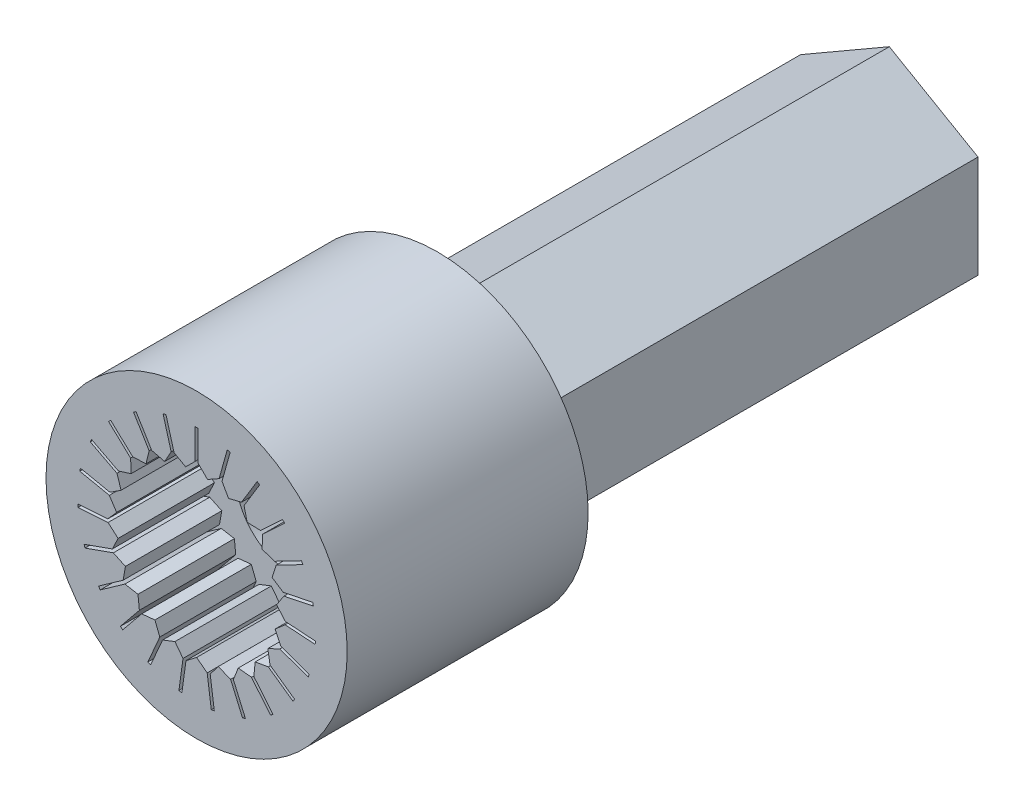
from build123d import *

# Parameters (mm, degrees)
EXTRUDE_1_DEPTH     = 15
SKETCH_6_R          = 5
EXTRUDE_3_DEPTH     = 8
CUT_EXTRUDE_5_DEPTH = 3.2
CHAMFER_1_SIZE      = 1
SKETCH_7_R          = 1.9
CUT_EXTRUDE_6_DEPTH = 25.062418831


with BuildPart() as part:
    # ｽｹｯﾁ1 → ﾎﾞｽ - 押し出し1 (new body)
    with BuildSketch(Plane.XY):
        Polygon((0, 3.4), (-2.944486373, 1.7), (-2.944486373, -1.7), (0, -3.4), (2.944486373, -1.7), (2.944486373, 1.7), align=None)
    extrude(amount=EXTRUDE_1_DEPTH)

    # ｽｹｯﾁ6 → ﾎﾞｽ - 押し出し3 (add)
    with BuildSketch(Plane.XY.offset(15)):
        Circle(SKETCH_6_R)
    extrude(amount=EXTRUDE_3_DEPTH)

    # ｽｹｯﾁ5 → ｶｯﾄ - 押し出し5 (cut)
    with BuildSketch(Plane.XY.offset(23)):
        Polygon((-0.05, 2.95), (-0.05, 3.95), (0.05, 3.95), (0.05, 2.95), (0.362514094, 2.637485906), (0.747754611, 2.854095836), (1.017551382, 3.817013124), (1.11384311, 3.790033446), (0.844046339, 2.827116159), (1.060656269, 2.441875642), (1.490051682, 2.546516441), (2.009635632, 3.400935845), (2.095077573, 3.34897745), (1.575493623, 2.494558046), (1.680134421, 2.065162633), (2.121838437, 2.050073571), (2.852674402, 2.732626714), (2.920929716, 2.659543117), (2.190093752, 1.976989974), (2.17500469, 1.535285958), (2.596258142, 1.401586122), (3.484143361, 1.86165116), (3.530149865, 1.772862638), (2.642264646, 1.3127976), (2.50856481, 0.891544148), (2.878125258, 0.649149443), (3.857209346, 0.852605456), (3.877554947, 0.754697047), (2.898470859, 0.551241034), (2.656076155, 0.181680586), (2.94653499, -0.151431681), (3.944203759, -0.219674094), (3.937379518, -0.319440971), (2.939710748, -0.251198558), (2.606598481, -0.541657393), (2.796413701, -0.94078181), (3.738674623, -1.275661422), (3.705186662, -1.369887514), (2.76292574, -1.035007902), (2.363801323, -1.224823122), (2.4388952, -1.660358456), (3.255865093, -2.237038778), (3.198197061, -2.318735767), (2.381227168, -1.742055445), (1.945691834, -1.817149322), (1.900495, -2.25679391), (2.531582945, -3.032505201), (2.454011816, -3.095613995), (1.822923871, -2.319902705), (1.383279283, -2.274705871), (1.22114378, -2.685853285), (1.61954487, -3.603064586), (1.52782374, -3.642904695), (1.12942265, -2.725693394), (0.718275236, -2.563557891), (0.451225912, -2.915715208), (0.587392561, -3.906401154), (0.488323967, -3.920017819), (0.352157318, -2.929331873), (0, -2.66228255), (-0.352157318, -2.929331873), (-0.488323967, -3.920017819), (-0.587392561, -3.906401154), (-0.451225912, -2.915715208), (-0.718275236, -2.563557891), (-1.12942265, -2.725693394), (-1.52782374, -3.642904695), (-1.61954487, -3.603064586), (-1.22114378, -2.685853285), (-1.383279283, -2.274705871), (-1.822923871, -2.319902705), (-2.454011816, -3.095613995), (-2.531582945, -3.032505201), (-1.900495, -2.25679391), (-1.945691834, -1.817149322), (-2.381227168, -1.742055445), (-3.198197061, -2.318735767), (-3.255865093, -2.237038778), (-2.4388952, -1.660358456), (-2.363801323, -1.224823122), (-2.76292574, -1.035007902), (-3.705186662, -1.369887514), (-3.738674623, -1.275661422), (-2.796413701, -0.94078181), (-2.606598481, -0.541657393), (-2.939710748, -0.251198558), (-3.937379518, -0.319440971), (-3.944203759, -0.219674094), (-2.94653499, -0.151431681), (-2.656076155, 0.181680586), (-2.898470859, 0.551241034), (-3.877554947, 0.754697047), (-3.857209346, 0.852605456), (-2.878125258, 0.649149443), (-2.50856481, 0.891544148), (-2.642264646, 1.3127976), (-3.530149865, 1.772862638), (-3.484143361, 1.86165116), (-2.596258142, 1.401586122), (-2.17500469, 1.535285958), (-2.190093752, 1.976989974), (-2.920929716, 2.659543117), (-2.852674402, 2.732626714), (-2.121838437, 2.050073571), (-1.680134421, 2.065162633), (-1.575493623, 2.494558046), (-2.095077573, 3.34897745), (-2.009635632, 3.400935845), (-1.490051682, 2.546516441), (-1.060656269, 2.441875642), (-0.844046339, 2.827116159), (-1.11384311, 3.790033446), (-1.017551382, 3.817013124), (-0.747754611, 2.854095836), (-0.362514094, 2.637485906), align=None)
    extrude(amount=-CUT_EXTRUDE_5_DEPTH, mode=Mode.SUBTRACT)

    # 面取り1
    chamfer_1_edges = [part.edges().sort_by_distance(p)[0] for p in [
        (1.472243186, 2.55, 15),
        (2.944486373, 0, 15),
        (1.472243186, -2.55, 15),
        (-1.472243186, -2.55, 15),
        (-2.944486373, 0, 15),
        (-1.472243186, 2.55, 15),
    ]]
    chamfer(chamfer_1_edges, length=CHAMFER_1_SIZE)

    # ｽｹｯﾁ7 → ｶｯﾄ - 押し出し6 (cut, through all)
    with BuildSketch(Plane(origin=(0, 0, 0), x_dir=(-1, 0, 0), z_dir=(0, 0, -1))):
        Circle(SKETCH_7_R)
    extrude(amount=-CUT_EXTRUDE_6_DEPTH, mode=Mode.SUBTRACT)


solid = part.part
